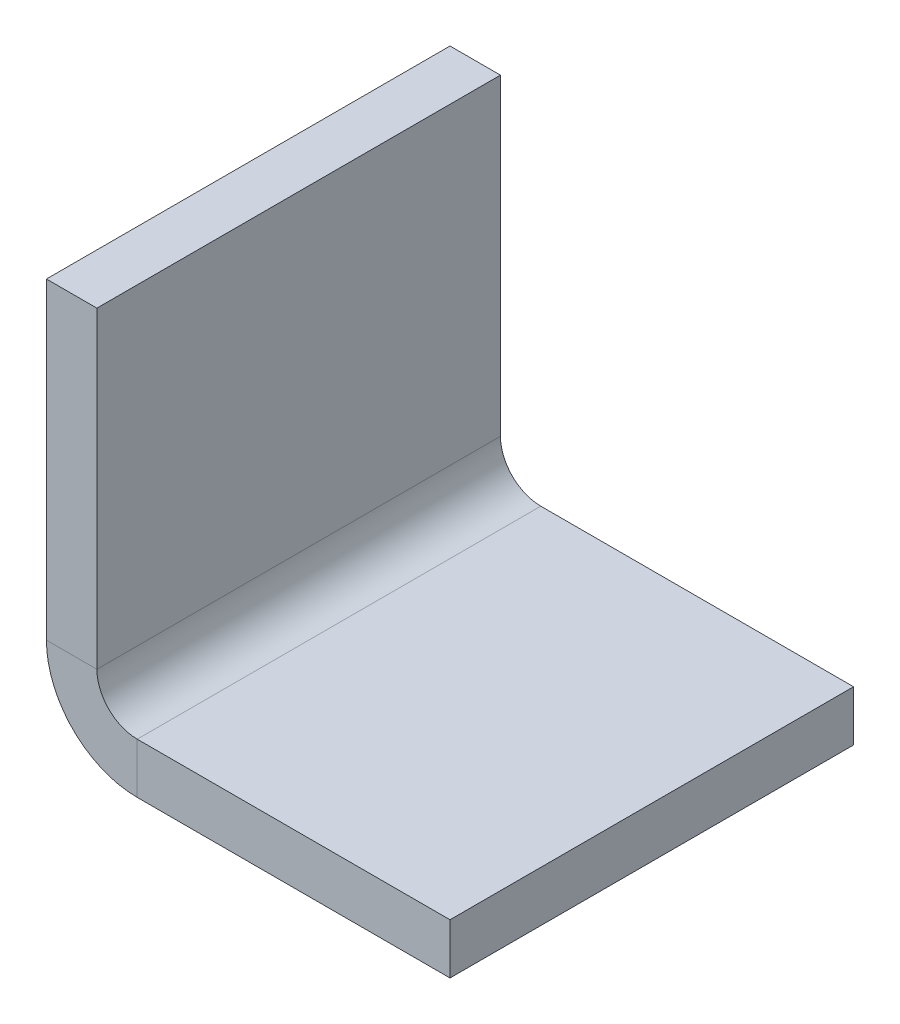
from build123d import *

# Parameters (mm, degrees)
BASE_FLANGE1_DEPTH = 12.7


# Sheet-metal steps are written as plain solids
with BuildPart() as part:
    # Sketch1 → Base-Flange1 (new body)
    with BuildSketch(Plane.XY):
        with BuildLine():
            Line((12.7, 0), (2.8575, 0))
            ThreePointArc((2.8575, 0), (0.836942373, 0.836942373), (0, 2.8575))
            Line((0, 2.8575), (0, 12.7))
            Line((0, 12.7), (1.5875, 12.7))
            Line((1.5875, 12.7), (1.5875, 2.8575))
            ThreePointArc((1.5875, 2.8575), (1.959474388, 1.959474388), (2.8575, 1.5875))
            Line((2.8575, 1.5875), (12.7, 1.5875))
            Line((12.7, 1.5875), (12.7, 0))
        make_face()
    extrude(amount=BASE_FLANGE1_DEPTH)


solid = part.part
